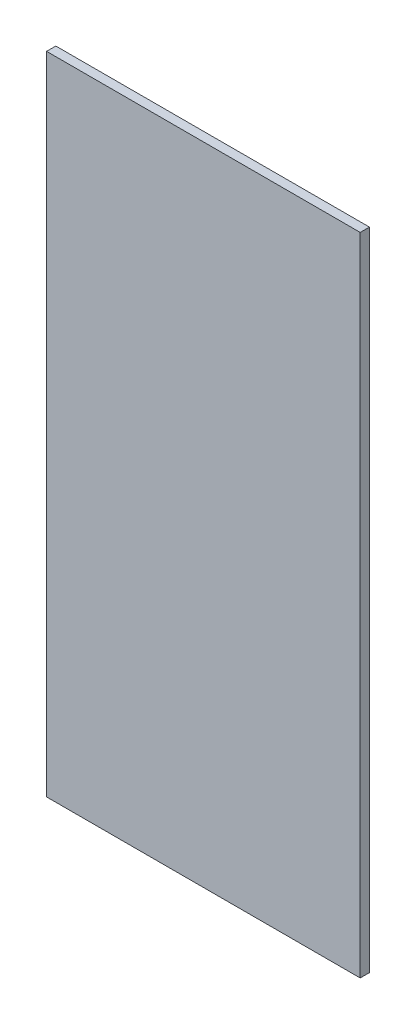
from build123d import *

# Parameters (mm, degrees)
SKETCH1_W           = 215.9
SKETCH1_H           = 444.5
BOSS_EXTRUDE1_DEPTH = 6.35


with BuildPart() as part:
    # Sketch1 → Boss-Extrude1 (new body)
    with BuildSketch(Plane.XY):
        with Locations((-107.95, -222.25)):
            Rectangle(SKETCH1_W, SKETCH1_H)
    extrude(amount=BOSS_EXTRUDE1_DEPTH)


solid = part.part
